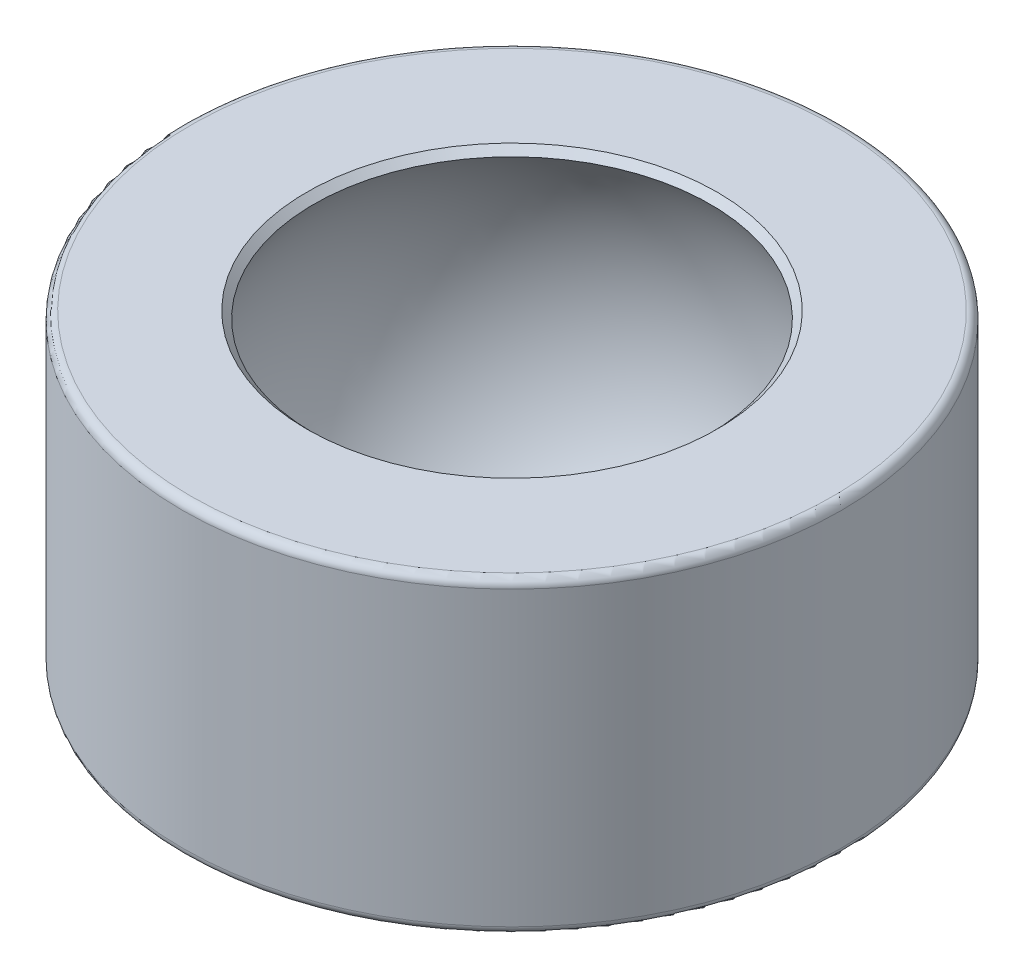
from build123d import *

# Parameters (mm, degrees)
BOSS_EXTRUDE1_DEPTH      = 1.875
BOSS_EXTRUDE1_DEPTH_BACK = 1.875
SKETCH1_R                = 4
SKETCH1_R_2              = 2
FILLET2_R                = 0.1
CHAMFER2_SIZE            = 0.106714114
CHAMFER2_SIZE_2          = 0.15


with BuildPart() as part:
    # Sketch1 → Boss-Extrude1 (new, two sides: drawn at the far end of the back side and taken through both)
    with BuildSketch(Plane(origin=(0, 0, 0), x_dir=(1, 0, 0), z_dir=(0, 1, 0)).offset(-BOSS_EXTRUDE1_DEPTH_BACK)):
        with Locations(Location((0, 0, 0), (0, 0, 270))):
            Circle(SKETCH1_R)
        with Locations(Location((0, 0, 0), (0, 0, 270))):
            Circle(SKETCH1_R_2, mode=Mode.SUBTRACT)
    extrude(amount=BOSS_EXTRUDE1_DEPTH + BOSS_EXTRUDE1_DEPTH_BACK)


with BuildPart() as body_2:
    # Sketch2 → Revolve2 (revolve)
    with BuildSketch(Plane(origin=(0, 0, 0), x_dir=(1, 0, 0), z_dir=(0, 1, 0))):
        with BuildLine():
            Line((0, 3), (0, -3))
            ThreePointArc((0, -3), (-3, 0), (0, 3))
        make_face()
    revolve(axis=Axis((0, 0, -3), (0, 0, 1)))


with BuildPart() as part_1:
    add(part.part)

    # Combine1: cut body 2
    add(body_2.part, mode=Mode.SUBTRACT)

    # Fillet2
    fillet2_edges = [part_1.edges().sort_by_distance(p)[0] for p in [
        (0, -1.875, -4),
        (0, 1.875, -4),
    ]]
    fillet(fillet2_edges, radius=FILLET2_R)

    # Chamfer2
    # the kernel refuses this chamfer: 0.15, 0.106714114 mm, written as the material it takes off along each edge
    with BuildSketch(Plane(origin=(0, -1.875, 0), x_dir=(0, 0, 1), z_dir=(-1, 0, 0))) as chamfer2_piece_1:
        with BuildLine():
            Line((2.435009088, 0.122649938), (2.341874249 + CHAMFER2_SIZE * 1.00000000139, 0))
            Line((2.341874249 + CHAMFER2_SIZE * 1.00000000139, 0), (2.341874249, 0))
            ThreePointArc((2.341874249, 0), (2.390544922, 0.062461731), (2.435009088, 0.122649938))
        make_face()
    revolve(axis=Axis((0, -1.875, 0), (0, 1, 0)), mode=Mode.SUBTRACT)
    with BuildSketch(Plane(origin=(0, 1.875, 0), x_dir=(0, 0, 1), z_dir=(-1, 0, 0))) as chamfer2_piece_2:
        with BuildLine():
            Line((2.341874249 + CHAMFER2_SIZE_2, 0), (2.407214516, -0.084659733))
            ThreePointArc((2.407214516, -0.084659733), (2.375156045, -0.042342432), (2.341874249, 0))
            Line((2.341874249, 0), (2.341874249 + CHAMFER2_SIZE_2, 0))
        make_face()
    revolve(axis=Axis((0, 1.875, 0), (0, 1, 0)), mode=Mode.SUBTRACT)


solid = part_1.part
